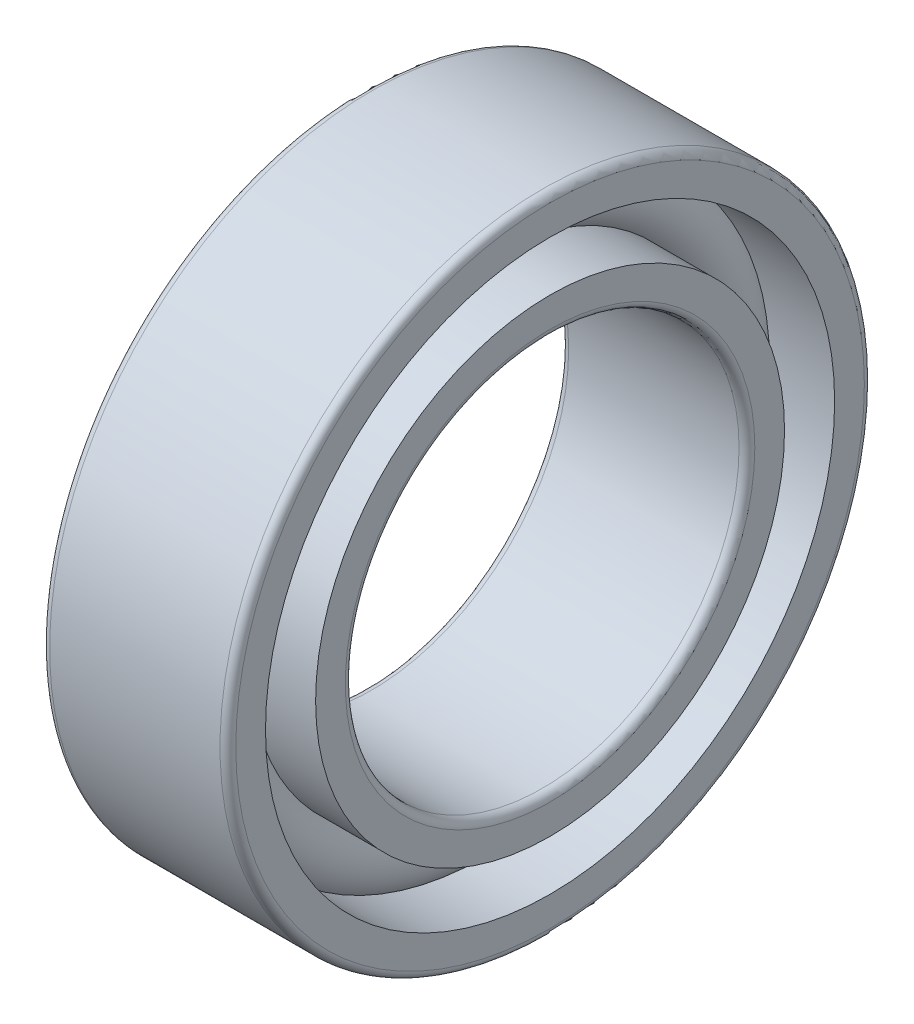
from build123d import *

# Parameters (mm, degrees)
CAGSPISKE_W     = 1.05
CAGSPISKE_H     = 1.75
CAGESPINE_ANGLE = 0.001
BALSIMSKE_R     = 5.25


with BuildPart() as part:
    # CagSpiSke → CageSpine (revolve)
    with BuildSketch(Plane.XY):
        with Locations((0, 36.25)):
            Rectangle(CAGSPISKE_W, CAGSPISKE_H)
    revolve(axis=Axis((-20.6375, 0, 0), (-1, 0, 0)), revolution_arc=CAGESPINE_ANGLE)

    # BalSimSke → BallsSimplified (revolve)
    with BuildSketch(Plane.XY):
        with Locations((0, 36.25)):
            Circle(BALSIMSKE_R)
    revolve(axis=Axis((-10, 0, 0), (1, 0, 0)))

    # InnRacSke → InnerRace (revolve)
    with BuildSketch(Plane.XY):
        with BuildLine():
            Line((-3.8795135, 32.75), (-13, 32.75))
            Line((-13, 32.75), (-13, 28.6))
            ThreePointArc((-13, 28.6), (-12.677817459, 27.822182541), (-11.9, 27.5))
            Line((-11.9, 27.5), (11.9, 27.5))
            ThreePointArc((11.9, 27.5), (12.677817459, 27.822182541), (13, 28.6))
            Line((13, 28.6), (13, 32.75))
            Line((13, 32.75), (3.8795135, 32.75))
            ThreePointArc((3.8795135, 32.75), (0, 31.025), (-3.8795135, 32.75))
        make_face()
    revolve(axis=Axis((-20.6375, 0, 0), (1, 0, 0)))

    # OutRacSke → OuterRace (revolve)
    with BuildSketch(Plane.XY):
        with BuildLine():
            Line((-3.8795135, 39.75), (-13, 39.75))
            Line((-13, 39.75), (-13, 43.9))
            ThreePointArc((-13, 43.9), (-12.677817459, 44.677817459), (-11.9, 45))
            Line((-11.9, 45), (11.9, 45))
            ThreePointArc((11.9, 45), (12.677817459, 44.677817459), (13, 43.9))
            Line((13, 43.9), (13, 39.75))
            Line((13, 39.75), (3.8795135, 39.75))
            ThreePointArc((3.8795135, 39.75), (0, 41.475), (-3.8795135, 39.75))
        make_face()
    revolve(axis=Axis((-20.6375, 0, 0), (1, 0, 0)))


solid = part.part
